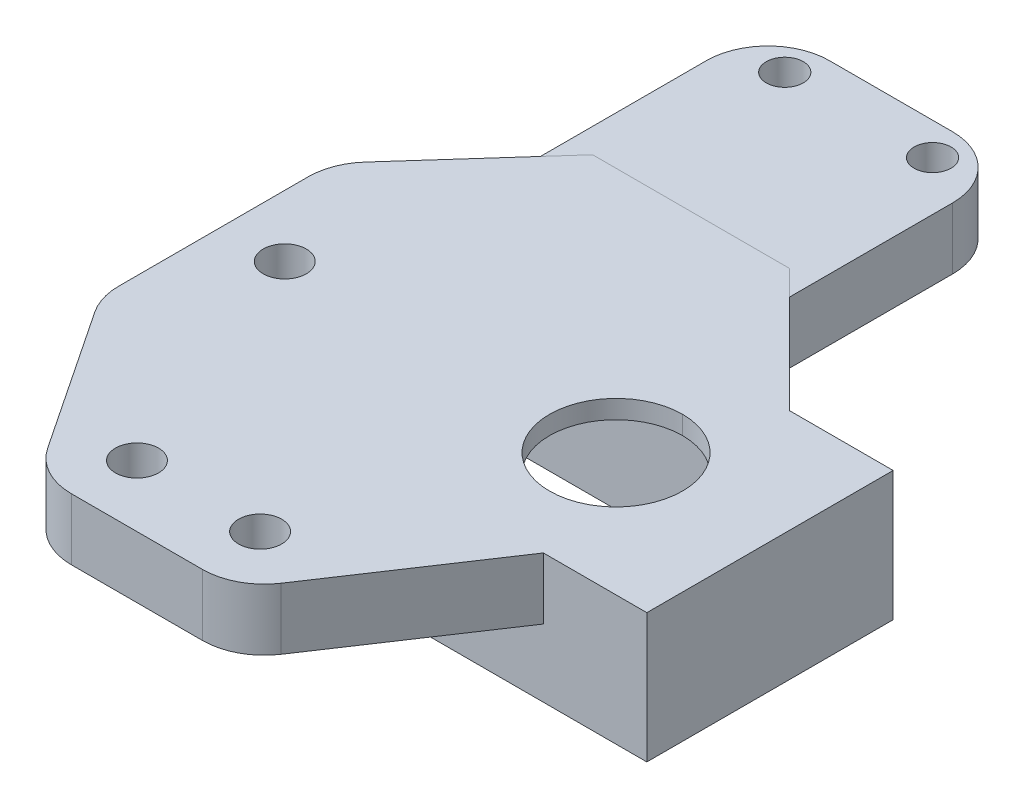
from build123d import *

# Parameters (mm, degrees)
SKETCH1_R           = 1.75
SKETCH1_W           = 7.2
SKETCH1_H           = 5.4
BOSS_EXTRUDE1_DEPTH = 5
FILLET5_RADIUS      = 10
FILLET5_LENGTH      = 5
FILLET2_R           = 5.4
FILLET6_R           = 5.4
SKETCH3_W           = 35
SKETCH3_H           = 20
SKETCH3_W_2         = 23
SKETCH3_H_2         = 13
BOSS_EXTRUDE4_DEPTH = 5.5
SKETCH5_W           = 23
SKETCH5_H           = 13
CUT_EXTRUDE1_DEPTH  = 3.5
CUT_EXTRUDE2_DEPTH  = 76.201396264
SKETCH9_R           = 1.5
CUT_EXTRUDE4_DEPTH  = 7
ESQUISSE4_R         = 1.5
BOSS_EXTRU_1_DEPTH  = 5
CONG_1_R            = 5
CONG_2_R            = 5


with BuildPart() as part:
    # Sketch1 → Boss-Extrude1 (new body)
    # profile 1 of 4: a face of its own
    with BuildSketch(Plane(origin=(0, 0, 0), x_dir=(1, 0, 0), z_dir=(0, 1, 0))):
        with BuildLine():
            Line((3.25, 25), (0, 25))
            Line((0, 25), (0, 15))
            Line((0, 15), (10, 0))
            Line((10, 0), (26, 0))
            Line((26, 0), (36, 15))
            Line((36, 15), (60, 15))
            Line((60, 15), (60, 25))
            Line((60, 25), (44.5, 25))
            Line((44.5, 25), (44.5, 19.6))
            Line((44.5, 19.6), (37.3, 19.6))
            Line((37.3, 19.6), (26.5, 19.6))
            Line((26.5, 19.6), (26.5, 25))
            Line((26.5, 25), (6.75, 25))
            ThreePointArc((6.75, 25), (5, 23.25), (3.25, 25))
        make_face()
        with Locations(Location((13, 5, 0), (0, 0, 270))):
            Circle(SKETCH1_R, mode=Mode.SUBTRACT)
        with Locations(Location((23, 5, 0), (0, 0, 270))):
            Circle(SKETCH1_R, mode=Mode.SUBTRACT)
    # profile 2 of 4: a face of its own
    with BuildSketch(Plane(origin=(0, 0, 0), x_dir=(1, 0, 0), z_dir=(0, 1, 0))):
        with BuildLine():
            Line((10, 45), (0, 33.819660113))
            Line((0, 33.819660113), (0, 25))
            Line((0, 25), (3.25, 25))
            ThreePointArc((3.25, 25), (5, 26.75), (6.75, 25))
            Line((6.75, 25), (26.5, 25))
            Line((26.5, 25), (26.5, 30.4))
            Line((26.5, 30.4), (37.3, 30.4))
            Line((37.3, 30.4), (44.5, 30.4))
            Line((44.5, 30.4), (44.5, 25))
            Line((44.5, 25), (60, 25))
            Line((60, 25), (60, 35))
            Line((60, 35), (36, 35))
            Line((36, 35), (26, 45))
            Line((26, 45), (10, 45))
        make_face()
    # profile 3 of 4: a face of its own
    with BuildSketch(Plane(origin=(0, 0, 0), x_dir=(1, 0, 0), z_dir=(0, 1, 0))):
        with Locations((40.9, 27.7)):
            Rectangle(SKETCH1_W, SKETCH1_H)
    # profile 4 of 4: a face of its own
    with BuildSketch(Plane(origin=(0, 0, 0), x_dir=(1, 0, 0), z_dir=(0, 1, 0))):
        with Locations((40.9, 22.3)):
            Rectangle(SKETCH1_W, SKETCH1_H)
    extrude(amount=BOSS_EXTRUDE1_DEPTH)

    # Fillet5: full round fillet: the end face becomes a half cylinder, R = half its width
    fillet5_face = Plane((60, 2.5, -25), x_dir=(0, -1, 0), z_dir=(1, 0, 0))  # on the end face: x along it, z out of the body
    fillet5_slab = fillet5_face.offset(-FILLET5_RADIUS / 2) * Box(FILLET5_LENGTH, 2 * FILLET5_RADIUS, FILLET5_RADIUS, mode=Mode.PRIVATE)  # the body's end, R deep
    fillet5_round = Plane((50, 2.5, -25), x_dir=(1, 0, 0), z_dir=(0, -1, 0)) * Cylinder(FILLET5_RADIUS, FILLET5_LENGTH, mode=Mode.PRIVATE)  # its axis R under the face
    add(fillet5_slab - fillet5_round, mode=Mode.SUBTRACT)

    # Fillet2
    fillet2_edges = [part.edges().sort_by_distance(p)[0] for p in [
        (26.5, 2.5, -30.4),
        (26.5, 2.5, -19.6),
    ]]
    fillet(fillet2_edges, radius=FILLET2_R - 0.0001)  # a hair under: the kernel refuses the full size

    # Fillet6
    fillet6_edges = [part.edges().sort_by_distance(p)[0] for p in [
        (37.3, 2.5, -19.6),
        (37.3, 2.5, -30.4),
    ]]
    fillet(fillet6_edges, radius=FILLET6_R - 0.0001)  # a hair under: the kernel refuses the full size

    # Sketch3 → Boss-Extrude4 (add)
    with BuildSketch(Plane.XZ):
        with Locations((26.9, -25)):
            Rectangle(SKETCH3_W, SKETCH3_H)
        with Locations((26.9, -25)):
            Rectangle(SKETCH3_W_2, SKETCH3_H_2, mode=Mode.SUBTRACT)
    extrude(amount=BOSS_EXTRUDE4_DEPTH)

    # Sketch5 → Cut-Extrude1 (cut)
    with BuildSketch(Plane.XZ):
        with Locations((26.9, -25)):
            Rectangle(SKETCH5_W, SKETCH5_H)
    extrude(amount=-CUT_EXTRUDE1_DEPTH, mode=Mode.SUBTRACT)

    # Sketch6 → Cut-Extrude2 (cut, through all)
    with BuildSketch(Plane.XZ):
        with BuildLine():
            Line((44.4, -15), (44.4, -35))
            Line((44.4, -35), (50, -35))
            ThreePointArc((50, -35), (60, -25), (50, -15))
            Line((50, -15), (44.4, -15))
        make_face()
    extrude(amount=-CUT_EXTRUDE2_DEPTH, mode=Mode.SUBTRACT)

    # Sketch9 → Cut-Extrude4 (cut)
    with BuildSketch(Plane.XZ.offset(5.5)):
        with Locations(Location((13.1, -25, 0), (0, 0, 270))):
            Circle(SKETCH9_R)
        with Locations(Location((40.7, -25, 0), (0, 0, 270))):
            Circle(SKETCH9_R)
    extrude(amount=-CUT_EXTRUDE4_DEPTH, mode=Mode.SUBTRACT)

    # Congé2
    cong_2_edges = [part.edges().sort_by_distance(p)[0] for p in [
        (26, 2.5, 0),
        (10, 2.5, 0),
        (0, 2.5, -15),
        (0, 2.5, -33.819660113),
    ]]
    fillet(cong_2_edges, radius=CONG_2_R)


with BuildPart() as body_2:
    # Esquisse4 → Boss.-Extru.1 (new body)
    with BuildSketch(Plane(origin=(0, 5, 0), x_dir=(1, 0, 0), z_dir=(0, 1, 0))):
        Polygon((26, 45), (28, 43), (28, 61.232493039), (8, 61.232493039), (8, 42.763932023), (10, 45), align=None)
        with Locations(Location((12, 58.6, 0), (0, 0, 270))):
            Circle(ESQUISSE4_R, mode=Mode.SUBTRACT)
        with Locations(Location((24, 58.6, 0), (0, 0, 270))):
            Circle(ESQUISSE4_R, mode=Mode.SUBTRACT)
    extrude(amount=-BOSS_EXTRU_1_DEPTH)

    # Congé1
    cong_1_edges = [body_2.edges().sort_by_distance(p)[0] for p in [
        (28, 2.5, -61.232493039),
        (8, 2.5, -61.232493039),
    ]]
    fillet(cong_1_edges, radius=CONG_1_R)


solid = Compound([part.part, body_2.part])
